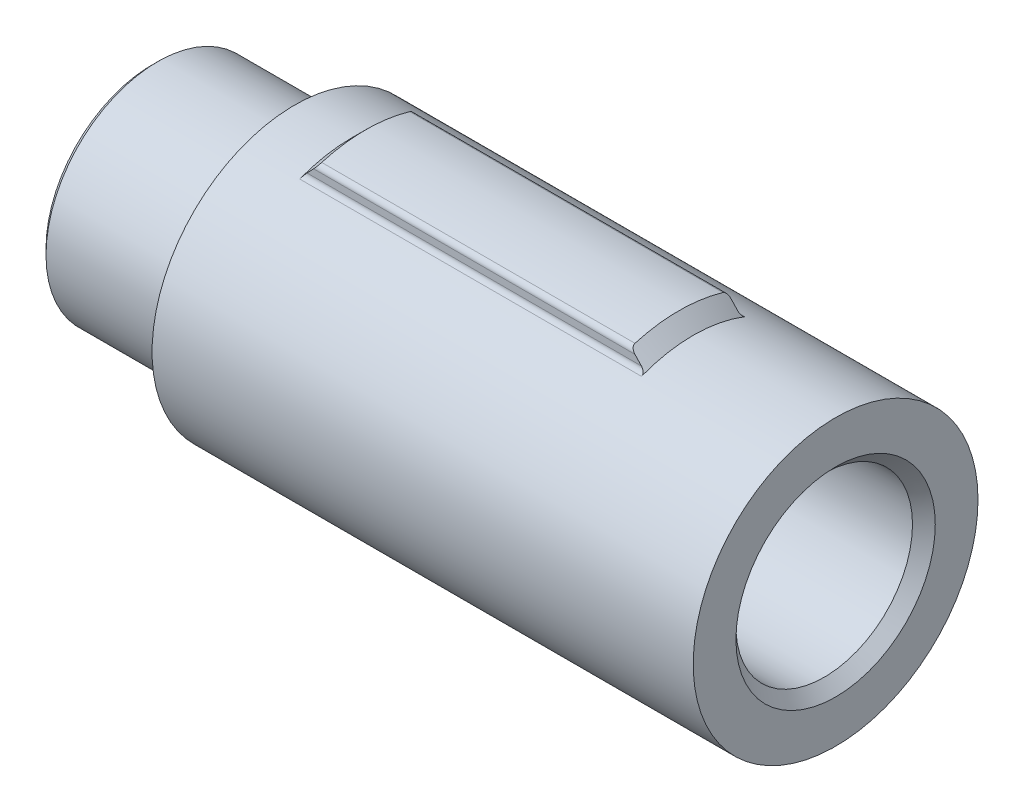
from build123d import *

# Parameters (mm, degrees)
SKETCH_1_R          = 5
EXTRUDE_1_DEPTH     = 19
SKETCH_3_R          = 3.1
CUT_EXTRUDE_1_DEPTH = 17
EXTRUDE_2_DEPTH     = 12
SKETCH_8_R          = 3.925
EXTRUDE_4_DEPTH     = 5
SKETCH_9_R          = 2.75
CUT_EXTRUDE_2_DEPTH = 5
EXTRUDE_5_DEPTH     = 3.2
FILLET_1_R          = 0.2
CHAMFER_1_SIZE      = 0.5
CHAMFER_2_SIZE      = 0.4
CHAMFER_3_SIZE      = 0.2


with BuildPart() as part:
    # 草图1 → 凸台-拉伸1 (new body)
    with BuildSketch(Plane(origin=(0, 0, 0), x_dir=(0, 0, -1), z_dir=(1, 0, 0))):
        Circle(SKETCH_1_R)
    extrude(amount=EXTRUDE_1_DEPTH)

    # 草图3 → 切除-拉伸1 (cut)
    with BuildSketch(Plane(origin=(19, 0, 0), x_dir=(0, 0, -1), z_dir=(1, 0, 0))):
        Circle(SKETCH_3_R)
    extrude(amount=-CUT_EXTRUDE_1_DEPTH, mode=Mode.SUBTRACT)

    # 草图5 → 凸台-拉伸2 (add)
    with BuildSketch(Plane(origin=(2, 0, 0), x_dir=(0, 0, -1), z_dir=(1, 0, 0))):
        with BuildLine():
            Line((-1.688194302, 2.6), (1.688194302, 2.6))
            Line((1.688194302, 2.6), (1.688194302, 5.234500931))
            ThreePointArc((1.688194302, 5.234500931), (0, 5.5), (-1.688194302, 5.234500931))
            Line((-1.688194302, 5.234500931), (-1.688194302, 2.6))
        make_face()
    extrude(amount=EXTRUDE_2_DEPTH)

    # 草图8 → 凸台-拉伸4 (add)
    with BuildSketch(Plane.ZY):
        Circle(SKETCH_8_R)
    extrude(amount=EXTRUDE_4_DEPTH)

    # 草图9 → 切除-拉伸2 (cut)
    with BuildSketch(Plane.ZY.offset(5)):
        Circle(SKETCH_9_R)
    extrude(amount=-CUT_EXTRUDE_2_DEPTH, mode=Mode.SUBTRACT)

    # 草图10 → 凸台-拉伸5 (add)
    with BuildSketch(Plane.ZY):
        Polygon((0.721687836, 1.25), (-0.721687836, 1.25), (-1.443375673, 0), (-0.721687836, -1.25), (0.721687836, -1.25), (1.443375673, 0), align=None)
    extrude(amount=EXTRUDE_5_DEPTH)

    # 圆角1
    fillet_1_edges = [part.edges().sort_by_distance(p)[0] for p in [
        (8, 4.70637865, 1.688194302),
        (8, 5.234500931, 1.688194302),
        (8, 4.70637865, -1.688194302),
        (8, 5.234500931, -1.688194302),
    ]]
    fillet(fillet_1_edges, radius=FILLET_1_R)

    # 倒角1
    # the kernel refuses this chamfer: 0.5 mm, written as the material it takes off along each edge
    with BuildSketch(Plane(origin=(14, 0, 0), x_dir=(0, 0.8686030413593419, -0.4955085837211114), z_dir=(0, -0.4955085837211114, -0.8686030413593419))) as chamfer_1_piece_1:
        Polygon((5.5, -CHAMFER_1_SIZE), (5.5 - CHAMFER_1_SIZE, 0), (5.5, 0), align=None)
    revolve(axis=Axis((14, 0, 0), (1, 0, 0)), revolution_arc=59.40658503, mode=Mode.SUBTRACT)
    with BuildSketch(Plane(origin=(2, 0, 0), x_dir=(0, 0.8686030413593415, -0.4955085837211117), z_dir=(0, -0.4955085837211117, -0.8686030413593415))) as chamfer_1_piece_2:
        Polygon((5.5 - CHAMFER_1_SIZE, 0), (5.5, CHAMFER_1_SIZE), (5.5, 0), align=None)
    revolve(axis=Axis((2, 0, 0), (1, 0, 0)), revolution_arc=59.40658503, mode=Mode.SUBTRACT)
    with BuildSketch(Plane(origin=(14, 2.6, 2.974035796), x_dir=(0.027495876610585623, 0.9996219169112968, 0), z_dir=(0, 0, -1))) as chamfer_1_piece_3_section:
        Polygon((CHAMFER_1_SIZE * 0.999621916911, -CHAMFER_1_SIZE * 0.0274958766106), (-CHAMFER_1_SIZE * 0.0274958766106, -CHAMFER_1_SIZE * 0.999621916911), (0, 0), align=None)
    chamfer_1_piece_3 = extrude(amount=5.948071591, mode=Mode.PRIVATE)
    chamfer_1_piece_3 = chamfer_1_piece_3 & Plane(origin=(13.821912141, 0, 0), x_dir=(0, 0, -1), z_dir=(1, 0, 0)) * Cylinder(3.1, 14, mode=Mode.PRIVATE)
    add(chamfer_1_piece_3, mode=Mode.SUBTRACT)

    # 倒角2
    chamfer_2_edges = [part.edges().sort_by_distance(p)[0] for p in [
        (19, 0, 3.1),
    ]]
    chamfer(chamfer_2_edges, length=CHAMFER_2_SIZE)

    # 倒角3
    chamfer_3_edges = [part.edges().sort_by_distance(p)[0] for p in [
        (-5, 0, -3.925),
        (-5, 0, -2.75),
        (-3.2, 0.625, 1.082531755),
        (-3.2, 1.25, 0),
        (-3.2, 0.625, -1.082531755),
        (-3.2, -0.625, -1.082531755),
        (-3.2, -1.25, 0),
        (-3.2, -0.625, 1.082531755),
    ]]
    chamfer(chamfer_3_edges, length=CHAMFER_3_SIZE)


solid = part.part
